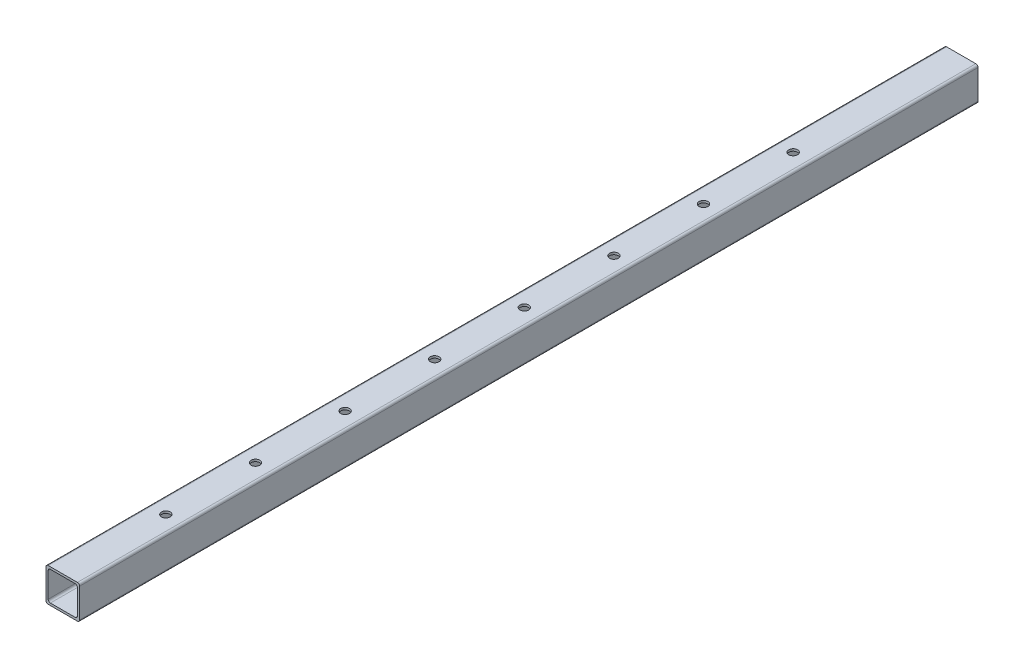
from build123d import *

# Parameters (mm, degrees)
SKETCH3_W           = 19.05
SKETCH3_H           = 19.05
SKETCH3_W_2         = 16.5608
SKETCH3_H_2         = 16.5608
BOSS_EXTRUDE1_DEPTH = 254.635
FILLET1_R           = 1.2446
SKETCH4_R           = 2.4892
CUT_EXTRUDE1_DEPTH  = 256.524189364


with BuildPart() as part:
    # Sketch3 → Boss-Extrude1 (new, symmetric)
    with BuildSketch(Plane.XY):
        Rectangle(SKETCH3_W, SKETCH3_H)
        Rectangle(SKETCH3_W_2, SKETCH3_H_2, mode=Mode.SUBTRACT)
    extrude(amount=BOSS_EXTRUDE1_DEPTH, both=True)

    # Fillet1
    fillet1_edges = [part.edges().sort_by_distance(p)[0] for p in [
        (-9.525, 9.525, 0),
        (8.2804, -8.2804, 0),
        (-8.2804, -8.2804, 0),
        (-8.2804, 8.2804, 0),
        (8.2804, 8.2804, 0),
        (9.525, -9.525, 0),
        (-9.525, -9.525, 0),
        (9.525, 9.525, 0),
    ]]
    fillet(fillet1_edges, radius=FILLET1_R)

    # Sketch4 → Cut-Extrude1 (cut, through all)
    with BuildSketch(Plane(origin=(0, 9.525, 0), x_dir=(1, 0, 0), z_dir=(0, 1, 0))):
        with Locations((0, 159.385)):
            Circle(SKETCH4_R)
        with Locations((0, 108.585)):
            Circle(SKETCH4_R)
        with Locations((0, 57.785)):
            Circle(SKETCH4_R)
        with Locations((0, 6.985)):
            Circle(SKETCH4_R)
        with Locations((0, -43.815)):
            Circle(SKETCH4_R)
        with Locations((0, -94.615)):
            Circle(SKETCH4_R)
        with Locations((0, -145.415)):
            Circle(SKETCH4_R)
        with Locations((0, -196.215)):
            Circle(SKETCH4_R)
    extrude(amount=-CUT_EXTRUDE1_DEPTH, mode=Mode.SUBTRACT)


solid = part.part
